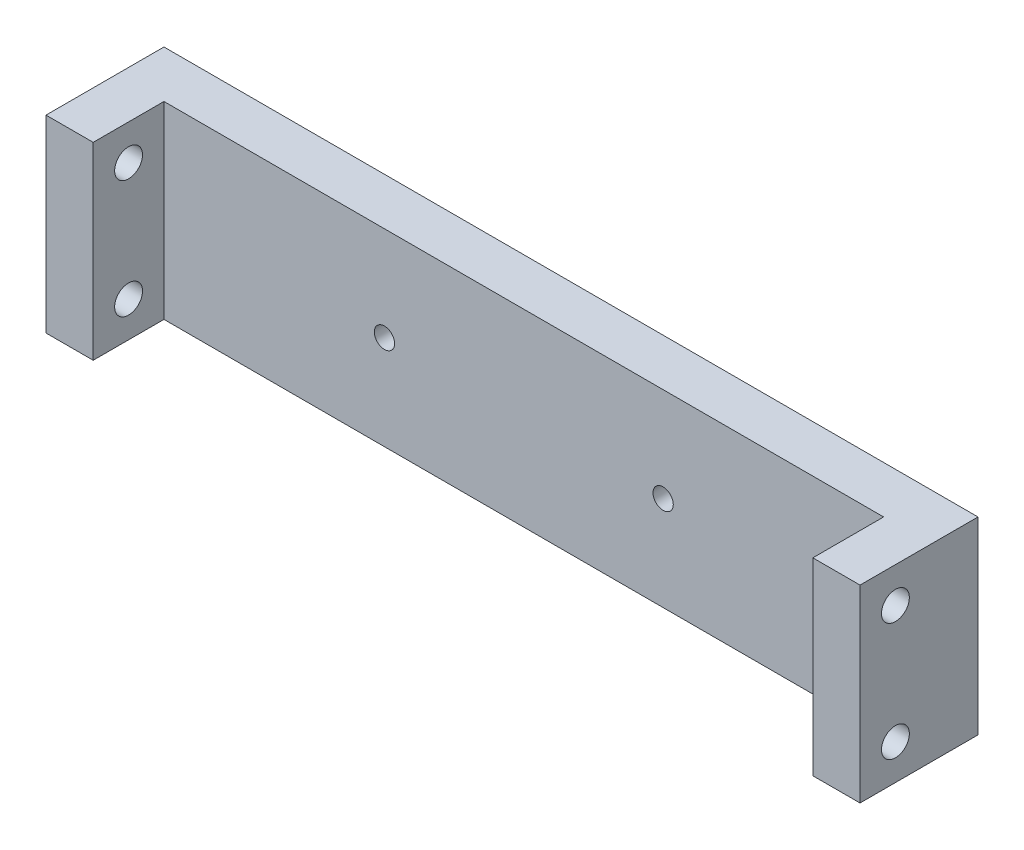
from build123d import *

# Parameters (mm, degrees)
SKETCH1_W               = 77.47
SKETCH1_H               = 20.32
SKETCH1_R               = 1.0922
BOSS_EXTRUDE1_DEPTH     = 5.08
SKETCH1_3_W             = 5.08
SKETCH1_3_H             = 20.32
BOSS_EXTRUDE2_DEPTH     = 12.7
CUT_EXTRUDE1_DEPTH      = 86.957517996
CUT_EXTRUDE1_DEPTH_BACK = 86.957517996
SKETCH2_R               = 1.5


with BuildPart() as part:
    # Sketch1 → Boss-Extrude1 (new body)
    with BuildSketch(Plane.XY):
        with Locations((43.815, 10.16)):
            Rectangle(SKETCH1_W, SKETCH1_H)
        with Locations((58.815, 10.16)):
            Circle(SKETCH1_R, mode=Mode.SUBTRACT)
        with Locations((28.815, 10.16)):
            Circle(SKETCH1_R, mode=Mode.SUBTRACT)
    extrude(amount=BOSS_EXTRUDE1_DEPTH)

    # Sketch1<3> → Boss-Extrude2 (add)
    with BuildSketch(Plane.XY):
        with Locations((85.09, 10.16)):
            Rectangle(SKETCH1_3_W, SKETCH1_3_H)
        with Locations((2.54, 10.16)):
            Rectangle(SKETCH1_3_W, SKETCH1_3_H)
    extrude(amount=BOSS_EXTRUDE2_DEPTH)

    # Sketch2 → Cut-Extrude1 (cut, two sides: drawn at the far end of the back side and taken through both)
    with BuildSketch(Plane.ZY.offset(-82.55).offset(-CUT_EXTRUDE1_DEPTH_BACK)):
        with Locations((8.89, 16.51)):
            Circle(SKETCH2_R)
        with Locations((8.89, 3.81)):
            Circle(SKETCH2_R)
    extrude(amount=CUT_EXTRUDE1_DEPTH + CUT_EXTRUDE1_DEPTH_BACK, mode=Mode.SUBTRACT)


solid = part.part
